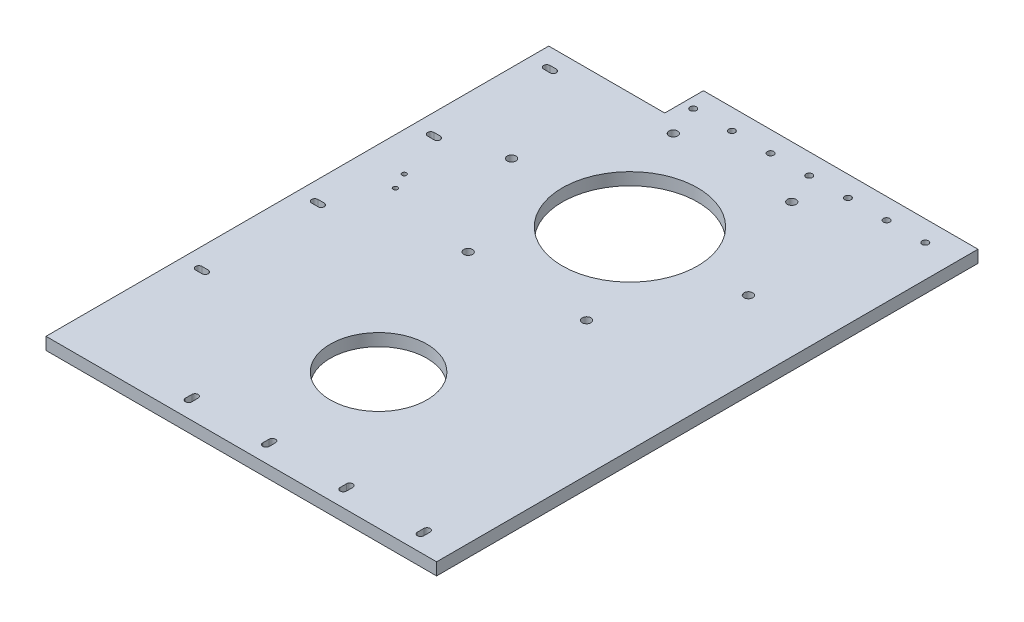
from build123d import *

# Parameters (mm, degrees)
BOSS_EXTRUDE1_DEPTH = 6.35
SKETCH9_R           = 1.65
CUT_EXTRUDE10_DEPTH = 30
CUT_EXTRUDE12_DEPTH = 30
CUT_EXTRUDE13_DEPTH = 10
SKETCH12_R          = 35
CUT_EXTRUDE14_DEPTH = 192.836707905
SKETCH13_R          = 2.25
CUT_EXTRUDE15_DEPTH = 192.836707905
SKETCH14_R          = 25
CUT_EXTRUDE16_DEPTH = 10
SKETCH15_R          = 1.175
CUT_EXTRUDE17_DEPTH = 10


with BuildPart() as part:
    # Sketch1 → Boss-Extrude1 (new body)
    with BuildSketch(Plane(origin=(0, 0, 0), x_dir=(1, 0, 0), z_dir=(0, 1, 0))):
        Polygon((-71, 140), (71, 140), (71, -140), (-131, -140), (-131, 120), (-71, 120), align=None)
    extrude(amount=BOSS_EXTRUDE1_DEPTH)

    # Sketch9 → Cut-Extrude10 (cut)
    with BuildSketch(Plane(origin=(0, 0, 0), x_dir=(-1, 0, 0), z_dir=(0, -1, 0))):
        with Locations((45.6, 129.325)):
            Circle(SKETCH9_R)
        with Locations((5.6, 129.325)):
            Circle(SKETCH9_R)
        with Locations((-34.4, 129.325)):
            Circle(SKETCH9_R)
        with Locations((65.6, 129.325)):
            Circle(SKETCH9_R)
        with Locations((25.6, 129.325)):
            Circle(SKETCH9_R)
        with Locations((-14.4, 129.325)):
            Circle(SKETCH9_R)
        with Locations((-54.4, 129.325)):
            Circle(SKETCH9_R)
    extrude(amount=-CUT_EXTRUDE10_DEPTH, mode=Mode.SUBTRACT)

    # Sketch11 → Cut-Extrude12 (cut)
    with BuildSketch(Plane(origin=(0, 6.35, 0), x_dir=(1, 0, 0), z_dir=(0, 1, 0))):
        with BuildLine():
            Line((-63.95, -128.355), (-63.95, -131.655))
            ThreePointArc((-63.95, -131.655), (-65.6, -133.305), (-67.25, -131.655))
            Line((-67.25, -131.655), (-67.25, -128.355))
            ThreePointArc((-67.25, -128.355), (-65.6, -126.705), (-63.95, -128.355))
        make_face()
        with BuildLine():
            Line((-23.95, -128.353535871), (-23.95, -131.653535871))
            ThreePointArc((-23.95, -131.653535871), (-25.6, -133.303535871), (-27.25, -131.653535871))
            Line((-27.25, -131.653535871), (-27.25, -128.353535871))
            ThreePointArc((-27.25, -128.353535871), (-25.6, -126.703535871), (-23.95, -128.353535871))
        make_face()
        with BuildLine():
            Line((16.05, -128.352071742), (16.05, -131.652071742))
            ThreePointArc((16.05, -131.652071742), (14.4, -133.302071742), (12.75, -131.652071742))
            Line((12.75, -131.652071742), (12.75, -128.352071742))
            ThreePointArc((12.75, -128.352071742), (14.4, -126.702071742), (16.05, -128.352071742))
        make_face()
        with BuildLine():
            Line((56.05, -128.350607613), (56.05, -131.650607613))
            ThreePointArc((56.05, -131.650607613), (54.4, -133.300607613), (52.75, -131.650607613))
            Line((52.75, -131.650607613), (52.75, -128.350607613))
            ThreePointArc((52.75, -128.350607613), (54.4, -126.700607613), (56.05, -128.350607613))
        make_face()
    extrude(amount=-CUT_EXTRUDE12_DEPTH, mode=Mode.SUBTRACT)

    # Sketch10 → Cut-Extrude13 (cut)
    with BuildSketch(Plane.XZ):
        with BuildLine():
            ThreePointArc((-121.975, 11.65), (-123.625, 10), (-121.975, 8.35))
            Line((-121.975, 8.35), (-118.675, 8.35))
            ThreePointArc((-118.675, 8.35), (-117.025, 10), (-118.675, 11.65))
            Line((-118.675, 11.65), (-121.975, 11.65))
        make_face()
        with BuildLine():
            ThreePointArc((-121.975, 71.65), (-123.625, 70), (-121.975, 68.35))
            Line((-121.975, 68.35), (-118.675, 68.35))
            ThreePointArc((-118.675, 68.35), (-117.025, 70), (-118.675, 71.65))
            Line((-118.675, 71.65), (-121.975, 71.65))
        make_face()
        with BuildLine():
            ThreePointArc((-121.975, -48.35), (-123.625, -50), (-121.975, -51.65))
            Line((-121.975, -51.65), (-118.675, -51.65))
            ThreePointArc((-118.675, -51.65), (-117.025, -50), (-118.675, -48.35))
            Line((-118.675, -48.35), (-121.975, -48.35))
        make_face()
        with BuildLine():
            ThreePointArc((-121.975, -108.35), (-123.625, -110), (-121.975, -111.65))
            Line((-121.975, -111.65), (-118.675, -111.65))
            ThreePointArc((-118.675, -111.65), (-117.025, -110), (-118.675, -108.35))
            Line((-118.675, -108.35), (-121.975, -108.35))
        make_face()
    extrude(amount=-CUT_EXTRUDE13_DEPTH, mode=Mode.SUBTRACT)

    # Sketch12 → Cut-Extrude14 (cut, through all)
    with BuildSketch(Plane(origin=(0, 6.35, 0), x_dir=(1, 0, 0), z_dir=(0, 1, 0))):
        with Locations((-29, 60)):
            Circle(SKETCH12_R)
    extrude(amount=-CUT_EXTRUDE14_DEPTH, mode=Mode.SUBTRACT)

    # Sketch13 → Cut-Extrude15 (cut, through all)
    with BuildSketch(Plane(origin=(0, 6.35, 0), x_dir=(1, 0, 0), z_dir=(0, 1, 0))):
        with Locations((-90.25, 60)):
            Circle(SKETCH13_R)
        with Locations((-59.625, 113.044055982)):
            Circle(SKETCH13_R)
        with Locations((1.625, 113.044055982)):
            Circle(SKETCH13_R)
        with Locations((32.25, 60)):
            Circle(SKETCH13_R)
        with Locations((1.625, 6.955944018)):
            Circle(SKETCH13_R)
        with Locations((-59.625, 6.955944018)):
            Circle(SKETCH13_R)
    extrude(amount=-CUT_EXTRUDE15_DEPTH, mode=Mode.SUBTRACT)

    # Sketch14 → Cut-Extrude16 (cut)
    with BuildSketch(Plane(origin=(0, 6.35, 0), x_dir=(1, 0, 0), z_dir=(0, 1, 0))):
        with Locations((-29, -70)):
            Circle(SKETCH14_R)
    extrude(amount=-CUT_EXTRUDE16_DEPTH, mode=Mode.SUBTRACT)

    # Sketch15 → Cut-Extrude17 (cut)
    with BuildSketch(Plane(origin=(0, 6.35, 0), x_dir=(1, 0, 0), z_dir=(0, 1, 0))):
        with Locations((-111.024467158, 25.298909731)):
            Circle(SKETCH15_R)
        with Locations((-106.983736963, 16.701090269)):
            Circle(SKETCH15_R)
    extrude(amount=-CUT_EXTRUDE17_DEPTH, mode=Mode.SUBTRACT)


solid = part.part
